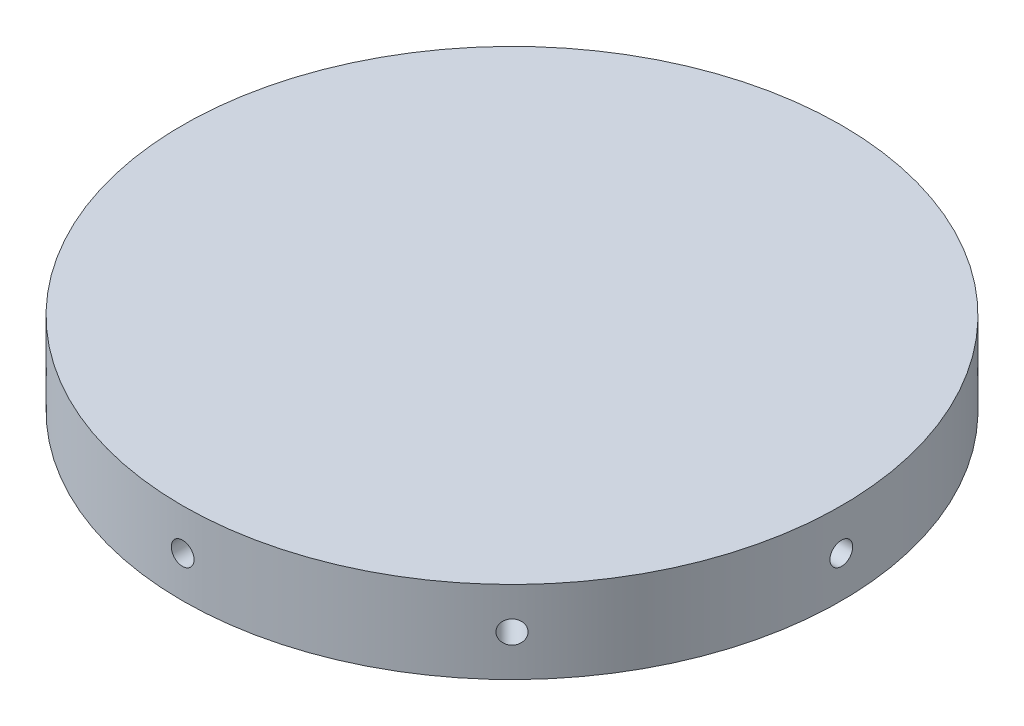
from build123d import *

# Parameters (mm, degrees)
SKETCH1_R           = 50.8
BOSS_EXTRUDE1_DEPTH = 12.7
SKETCH2_R           = 1.7526
CUT_EXTRUDE1_DEPTH  = 19.05
CIRPATTERN1_COUNT   = 8


with BuildPart() as part:
    # Sketch1 → Boss-Extrude1 (new body)
    with BuildSketch(Plane(origin=(0, 0, 0), x_dir=(1, 0, 0), z_dir=(0, 1, 0))):
        Circle(SKETCH1_R)
    extrude(amount=BOSS_EXTRUDE1_DEPTH)

    # Sketch2 → Cut-Extrude1 (cut)
    with BuildSketch(Plane.XY.offset(50.8)):
        with Locations((0, 6.35)):
            Circle(SKETCH2_R)
    cut_extrude1 = extrude(amount=-CUT_EXTRUDE1_DEPTH, mode=Mode.SUBTRACT)

    # CirPattern1: Cut-Extrude1 ×8 about axis
    cirpattern1_axis = Axis((0, 12.7, 0), (0, -1, 0))
    for i in range(1, CIRPATTERN1_COUNT):
        add(cut_extrude1.rotate(cirpattern1_axis, i * 360 / CIRPATTERN1_COUNT), mode=Mode.SUBTRACT)


solid = part.part
